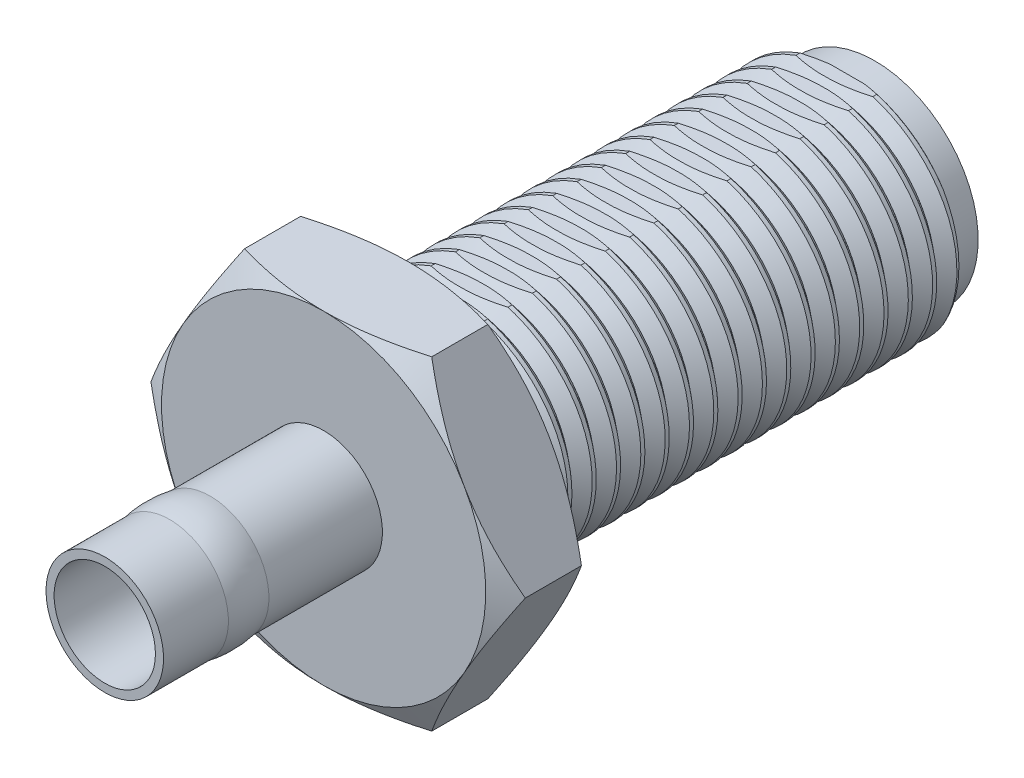
from build123d import *

# Parameters (mm, degrees)
BOSS_EXTRUDE1_DEPTH = 2.1
SKETCH5_R           = 2.35
CUT_EXTRUDE2_DEPTH  = 1.95
SKETCH6_R           = 0.4
SKETCH6_R_2         = 0.3
BOSS_EXTRUDE2_DEPTH = 0.1
SKETCH6_2_R         = 0.3
CUT_EXTRUDE3_DEPTH  = 19.111759532
CUT_SWEEP1_PITCH    = 0.6
SKETCH10_R          = 1.25
CUT_EXTRUDE4_DEPTH  = 5.4
CUT_EXTRUDE1_REACH  = 21.198


with BuildPart() as part:
    # Sketch1 → Revolve1 (revolve)
    with BuildSketch(Plane(origin=(0, 0, 0), x_dir=(0, 0, -1), z_dir=(1, 0, 0)), mode=Mode.PRIVATE) as revolve1_sk:
        with BuildLine():
            Line((0, 0), (0, 1.45))
            Line((0, 1.45), (1.6, 1.45))
            ThreePointArc((1.6, 1.45), (2.1, 1.5), (2.6, 1.45))
            Line((2.6, 1.45), (5.4, 1.45))
            Line((5.4, 1.45), (5.4, 4))
            Line((5.4, 4), (7.5, 4))
            Line((7.5, 4), (7.5, 2.875))
            Line((7.5, 2.875), (18.2, 2.875))
            Line((18.2, 2.875), (18.2, 2.55))
            Line((18.2, 2.55), (19, 2.55))
            Line((19, 2.55), (19, 0))
            Line((19, 0), (0, 0))
        make_face()
    revolve(revolve1_sk.sketch.rotate(Axis((0, 0, -19), (0, 0, 1)), 90), axis=Axis((0, 0, -19), (0, 0, 1)))

    # Sketch2 → Boss-Extrude1 (add)
    with BuildSketch(Plane(origin=(0, 0, -7.5), x_dir=(-1, 0, 0), z_dir=(0, 0, -1))):
        Polygon((2.309401077, 4), (-2.309401077, 4), (-4.618802154, 0), (-2.309401077, -4), (2.309401077, -4), (4.618802154, 0), align=None)
    extrude(amount=-BOSS_EXTRUDE1_DEPTH)

    # Sketch3 → Cut-Revolve1 (revolve, cut)
    with BuildSketch(Plane(origin=(0, 0, 0), x_dir=(0, 0, -1), z_dir=(1, 0, 0)), mode=Mode.PRIVATE) as cut_revolve1_sk:
        Polygon((4.822649731, 3), (4.822649731, 5.732050808), (6.4, 5.732050808), align=None)
        Polygon((6.5, 5.732050808), (8.077350269, 3), (8.077350269, 5.732050808), align=None)
    revolve(cut_revolve1_sk.sketch.rotate(Axis((0, 0, -5.4), (0, 0, -1)), 270), axis=Axis((0, 0, -5.4), (0, 0, -1)), mode=Mode.SUBTRACT)

    # Sketch5 → Cut-Extrude2 (cut)
    with BuildSketch(Plane(origin=(0, 0, -19), x_dir=(-1, 0, 0), z_dir=(0, 0, -1))):
        Circle(SKETCH5_R)
    extrude(amount=-CUT_EXTRUDE2_DEPTH, mode=Mode.SUBTRACT)

    # Sketch6 → Boss-Extrude2 (add)
    with BuildSketch(Plane(origin=(0, 0, -17.05), x_dir=(-1, 0, 0), z_dir=(0, 0, -1))):
        Circle(SKETCH6_R)
        Circle(SKETCH6_R_2, mode=Mode.SUBTRACT)
    extrude(amount=BOSS_EXTRUDE2_DEPTH)

    # Sketch6<2> → Cut-Extrude3 (cut, through all)
    with BuildSketch(Plane(origin=(0, 0, -17.05), x_dir=(-1, 0, 0), z_dir=(0, 0, -1))):
        Circle(SKETCH6_2_R)
    extrude(amount=-CUT_EXTRUDE3_DEPTH, mode=Mode.SUBTRACT)

    # Cut-Sweep1: arcs per turn and ends read off the stored shape
    # Cut-Sweep1: the profile of Sketch9 profile screwed along a right-hand helix through 18 turns, 6 arcs to a turn; built about Z, then put on its axis
    cut_sweep1_z = Axis((0, 0, 0), (0, 0, 1))
    cut_sweep1_corners = [(2.8753, 0, -0.85025), (2.8753, 0, -0.34975), (2.575, 0, -0.6)]
    with BuildLine(mode=Mode.PRIVATE) as cut_sweep1_profile:
        Line(cut_sweep1_corners[0], cut_sweep1_corners[1])
        Line(cut_sweep1_corners[1], cut_sweep1_corners[2])
        Line(cut_sweep1_corners[2], cut_sweep1_corners[0])
    cut_sweep1_cap = Face(cut_sweep1_profile.wire())
    cut_sweep1_turn_angles = [0, 30, 60, 90, 120, 150, 180, 210, 240, 270, 300, 330, 360]
    cut_sweep1_turn_weights = [1, 0.8660254037844387, 1, 0.8660254037844387, 1, 0.8660254037844387, 1, 0.8660254037844387, 1, 0.8660254037844387, 1, 0.8660254037844387, 1]
    cut_sweep1_turn_rails = [Edge.make_bspline([Vector(p[0], p[1], 0).rotate(cut_sweep1_z, cut_sweep1_turn_angles[k]) / cut_sweep1_turn_weights[k] + Vector(0, 0, p[2] + CUT_SWEEP1_PITCH * cut_sweep1_turn_angles[k] / 360) for k in range(13)], [0, 0, 0, 1, 1, 2, 2, 3, 3, 4, 4, 5, 5, 6, 6, 6], 2, cut_sweep1_turn_weights) for p in cut_sweep1_corners]
    cut_sweep1_turn_sides = [Face.make_surface_from_curves(cut_sweep1_turn_rails[p[0]], cut_sweep1_turn_rails[p[1]]) for p in [(0, 1), (1, 2), (2, 0)]]
    cut_sweep1 = Plane(origin=(0, 0, -18.2), x_dir=(-1, 0, 0), z_dir=(0, 0, 1)) * Solid(Shell([*[p.moved(Location((0, 0, CUT_SWEEP1_PITCH * i))) for i in range(18) for p in cut_sweep1_turn_sides], cut_sweep1_cap, cut_sweep1_cap.rotate(cut_sweep1_z, 6480).moved(Location((0, 0, CUT_SWEEP1_PITCH * 6480 / 360)))]))
    add(cut_sweep1, mode=Mode.SUBTRACT)

    # Sketch10 → Cut-Extrude4 (cut)
    with BuildSketch(Plane.XY):
        Circle(SKETCH10_R)
    extrude(amount=-CUT_EXTRUDE4_DEPTH, mode=Mode.SUBTRACT)

    # Cut-Extrude1: up to this face of the body (flat: up to its plane)
    cut_extrude1_end = Plane(part.part.faces().sort_by_distance((-3.886862915, 9e-09, -7.5))[0])
    # Sketch4 → Cut-Extrude1 (cut, up to the picked face)
    with BuildSketch(Plane(origin=(0, 0, -18.2), x_dir=(-1, 0, 0), z_dir=(0, 0, -1)), mode=Mode.PRIVATE) as cut_extrude1_sk1:
        with BuildLine():
            Line((-0.916515139, 2.725), (0.916515139, 2.725))
            ThreePointArc((0.916515139, 2.725), (0, 2.875), (-0.916515139, 2.725))
        make_face()
    cut_extrude1_tool1 = split(extrude(cut_extrude1_sk1.sketch, amount=-CUT_EXTRUDE1_REACH, mode=Mode.PRIVATE), bisect_by=cut_extrude1_end, keep=Keep.BOTH, mode=Mode.PRIVATE)
    add(cut_extrude1_tool1.solids().sort_by(Axis((0, 2.785136, -18.2), (0, 0, 1)))[0], mode=Mode.SUBTRACT)


solid = part.part
